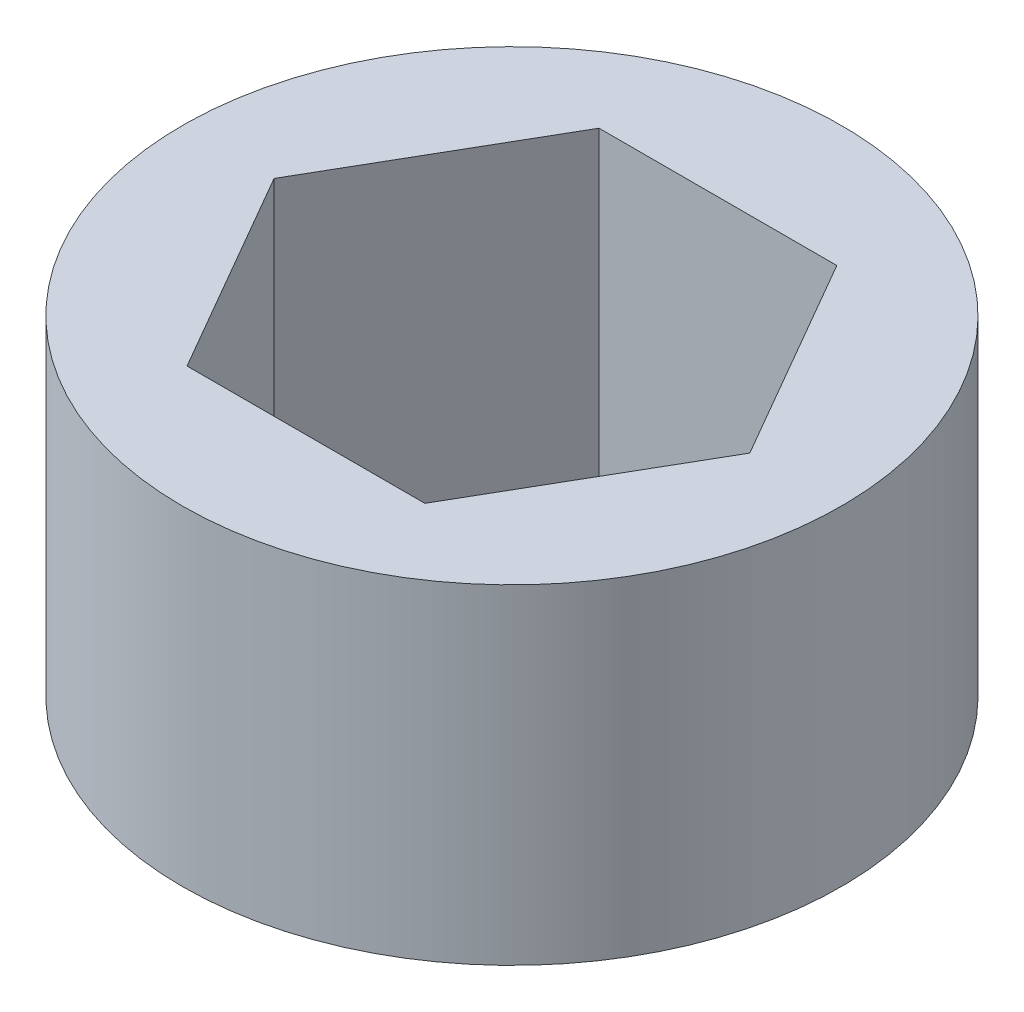
from build123d import *

# Parameters (mm, degrees)
SKETCH1_R           = 4
BOSS_EXTRUDE1_DEPTH = 4


with BuildPart() as part:
    # Sketch1 → Boss-Extrude1 (new body)
    with BuildSketch(Plane(origin=(0, 0, 0), x_dir=(1, 0, 0), z_dir=(0, 1, 0))):
        Circle(SKETCH1_R)
        Polygon((2.886751346, 0), (1.443375673, 2.5), (-1.443375673, 2.5), (-2.886751346, 0), (-1.443375673, -2.5), (1.443375673, -2.5), align=None, mode=Mode.SUBTRACT)
    extrude(amount=BOSS_EXTRUDE1_DEPTH)


solid = part.part
